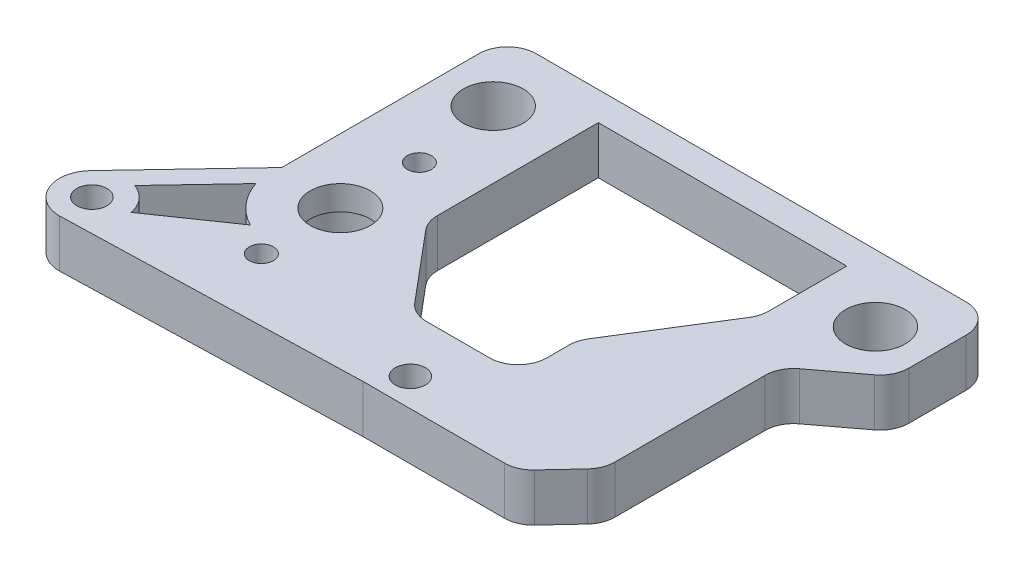
from build123d import *

# Parameters (mm, degrees)
SKETCH4_R           = 2
SKETCH4_R_2         = 5
SKETCH4_R_3         = 1.6
SKETCH4_R_4         = 3.96875
BOSS_EXTRUDE2_DEPTH = 6.35
SKETCH20_R          = 5
SKETCH20_R_2        = 4
BOSS_EXTRUDE4_DEPTH = 3.25


with BuildPart() as part:
    # Sketch4 → Boss-Extrude2 (new body)
    with BuildSketch(Plane(origin=(0, 0, 0), x_dir=(1, 0, 0), z_dir=(0, 1, 0))):
        with BuildLine():
            Line((21.46596982, -18.4375), (40.257702493, -18.4375))
            ThreePointArc((40.257702493, -18.4375), (41.776936446, -18.121498883), (43.044160097, -17.225913752))
            Line((43.044160097, -17.225913752), (46.444939319, -13.579024524))
            ThreePointArc((46.444939319, -13.579024524), (47.203372649, -12.376980446), (47.468481715, -10.980610773))
            Line((47.468481715, -10.980610773), (47.468481715, 8.985116992))
            ThreePointArc((47.468481715, 8.985116992), (47.868781798, 10.685130659), (48.985566477, 12.027918285))
            Line((48.985566477, 12.027918285), (54.680415238, 16.319294633))
            ThreePointArc((54.680415238, 16.319294633), (55.797199918, 17.662082259), (56.1975, 19.362095927))
            Line((56.1975, 19.362095927), (56.1975, 26.9875))
            ThreePointArc((56.1975, 26.9875), (55.081576836, 29.681576836), (52.3875, 30.7975))
            Line((52.3875, 30.7975), (-4.7625, 30.7975))
            ThreePointArc((-4.7625, 30.7975), (-7.456576836, 29.681576836), (-8.5725, 26.9875))
            Line((-8.5725, 26.9875), (-8.5725, 0.781747009))
            Line((-8.5725, 0.781747009), (-20.917416467, -12.27322702))
            ThreePointArc((-20.917416467, -12.27322702), (-21.745832178, -16.948010286), (-17.78, -19.558))
            Line((-17.78, -19.558), (21.46596982, -18.4375))
        make_face()
        with Locations((-17.78, -15.24)):
            Circle(SKETCH4_R, mode=Mode.SUBTRACT)
        with BuildLine():
            Line((-4.038317295, -7.919854381), (-13.417009712, -14.390093684))
            ThreePointArc((-13.417009712, -14.390093684), (-14.405104402, -12.347232345), (-16.272811714, -11.058324681))
            Line((-16.272811714, -11.058324681), (-8.444304622, -2.779535833))
            ThreePointArc((-8.444304622, -2.779535833), (-6.749791195, -5.78553531), (-4.038317295, -7.919854381))
        make_face(mode=Mode.SUBTRACT)
        Circle(SKETCH4_R_2, mode=Mode.SUBTRACT)
        with Locations((24.012521227, -14.703599027)):
            Circle(SKETCH4_R, mode=Mode.SUBTRACT)
        with Locations((0, 10.5)):
            Circle(SKETCH4_R_3, mode=Mode.SUBTRACT)
        with Locations((-1.5875, 21.9075)):
            Circle(SKETCH4_R_4, mode=Mode.SUBTRACT)
        with BuildLine():
            Line((7.3025, 26.9875), (40.3225, 26.9875))
            Line((40.3225, 26.9875), (40.3225, 16.611657969))
            ThreePointArc((40.3225, 16.611657969), (40.174907062, 15.561479644), (39.743563246, 14.592665573))
            Line((39.743563246, 14.592665573), (31.537418469, 1.460088735))
            ThreePointArc((31.537418469, 1.460088735), (31.106074654, 0.491274664), (30.958481715, -0.558903662))
            Line((30.958481715, -0.558903662), (30.958481715, -3.507298313))
            ThreePointArc((30.958481715, -3.507298313), (29.842558552, -6.20137515), (27.148481715, -7.317298313))
            Line((27.148481715, -7.317298313), (18.766481715, -7.317298313))
            ThreePointArc((18.766481715, -7.317298313), (17.156306138, -6.960330982), (15.847852387, -5.956319106))
            Line((15.847852387, -5.956319106), (8.193870672, 3.165341101))
            ThreePointArc((8.193870672, 3.165341101), (7.532271115, 4.311265148), (7.3025, 5.614361894))
            Line((7.3025, 5.614361894), (7.3025, 26.9875))
        make_face(mode=Mode.SUBTRACT)
        with Locations((49.2125, 21.9075)):
            Circle(SKETCH4_R_4, mode=Mode.SUBTRACT)
        with Locations((0, -10.5)):
            Circle(SKETCH4_R_3, mode=Mode.SUBTRACT)
    extrude(amount=-BOSS_EXTRUDE2_DEPTH)

    # Sketch20 → Boss-Extrude4 (add)
    with BuildSketch(Plane(origin=(0, 0, 0), x_dir=(1, 0, 0), z_dir=(0, 1, 0))):
        Circle(SKETCH20_R)
        Circle(SKETCH20_R_2, mode=Mode.SUBTRACT)
    extrude(amount=-BOSS_EXTRUDE4_DEPTH)


solid = part.part
